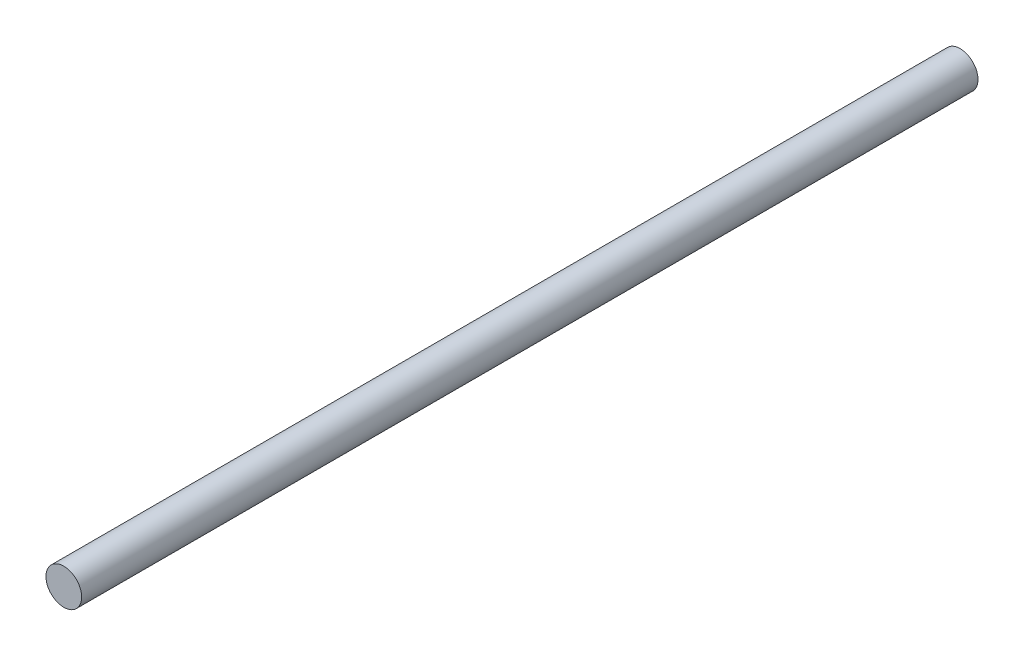
from build123d import *

# Parameters (mm, degrees)
SKETCH1_R           = 2.38125
BOSS_EXTRUDE1_DEPTH = 119.6848


with BuildPart() as part:
    # Sketch1 → Boss-Extrude1 (new body)
    with BuildSketch(Plane.XY):
        Circle(SKETCH1_R)
    extrude(amount=BOSS_EXTRUDE1_DEPTH)


solid = part.part
